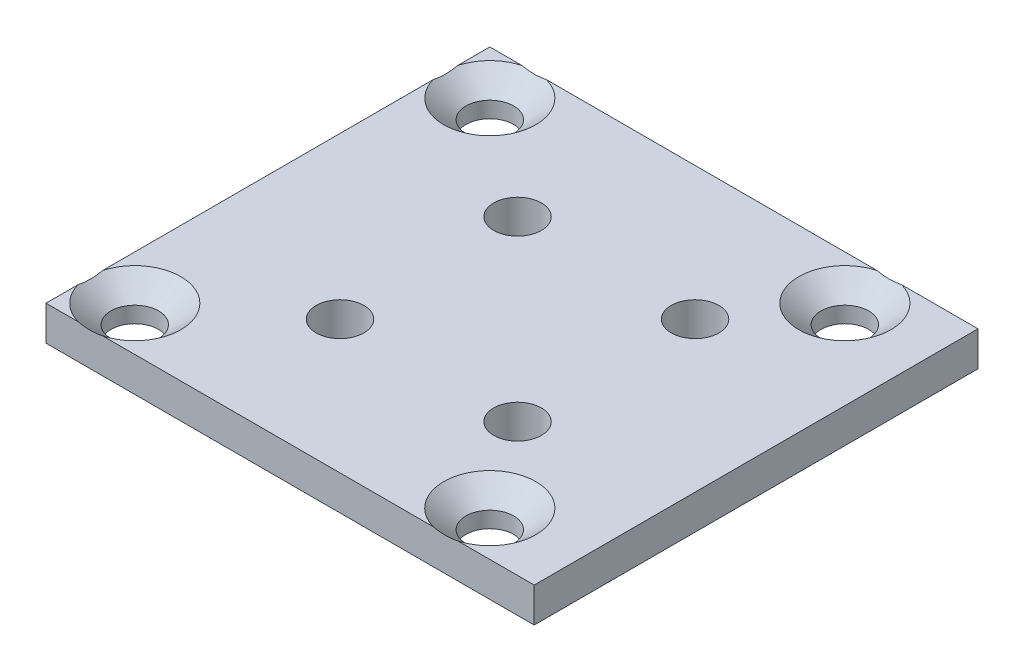
from build123d import *

# Parameters (mm, degrees)
SKETCH1_W            = 43
SKETCH1_H            = 40
BOSS_EXTRUDE1_DEPTH  = 3.125
M4_CLEARANCE_HOLE1_D = 4.3
M4_CLEARANCE_HOLE2_D = 4.3
SKETCH7_W            = 40
SKETCH7_H            = 3.125
BOSS_EXTRUDE2_DEPTH  = 1
CHAMFER1_SIZE        = 2
CHAMFER1_SIZE_2      = 1.678199262


with BuildPart() as part:
    # Sketch1 → Boss-Extrude1 (new body)
    with BuildSketch(Plane(origin=(0, 0, 0), x_dir=(1, 0, 0), z_dir=(0, 1, 0))):
        Rectangle(SKETCH1_W, SKETCH1_H)
    extrude(amount=BOSS_EXTRUDE1_DEPTH)

    # M4 Clearance Hole1 (through all)
    with Locations(Plane(origin=(0, 3.125, 0), x_dir=(1, 0, 0), z_dir=(0, 1, 0))):
        with Locations((-18.5, 16), (13.5, 16), (13.5, -16), (-18.5, -16)):
            Hole(M4_CLEARANCE_HOLE1_D / 2)

    # M4 Clearance Hole2 (through all)
    with Locations(Plane(origin=(0, 3.125, 0), x_dir=(1, 0, 0), z_dir=(0, 1, 0))):
        with Locations((-8, 8), (8, 8), (8, -8), (-8, -8)):
            Hole(M4_CLEARANCE_HOLE2_D / 2)

    # Sketch7 → Boss-Extrude2 (add)
    with BuildSketch(Plane.ZY.offset(21.5)):
        with Locations((0, 1.5625)):
            Rectangle(SKETCH7_W, SKETCH7_H)
    extrude(amount=BOSS_EXTRUDE2_DEPTH)

    # Chamfer1
    # the kernel refuses this chamfer: 2, 1.678199262 mm, written as the material it takes off along each edge
    with BuildSketch(Plane(origin=(-18.5, 3.125, 16), x_dir=(-1, 0, 0), z_dir=(0, 0, 1))) as chamfer1_piece_1:
        Polygon((2.15 + CHAMFER1_SIZE, 0), (2.15, CHAMFER1_SIZE_2), (2.15, 0), align=None)
    revolve(axis=Axis((-18.5, 3.125, 16), (0, -1, 0)), mode=Mode.SUBTRACT)
    with BuildSketch(Plane(origin=(13.5, 3.125, 16), x_dir=(-1, 0, 0), z_dir=(0, 0, 1))) as chamfer1_piece_2:
        Polygon((2.15 + CHAMFER1_SIZE, 0), (2.15, CHAMFER1_SIZE_2), (2.15, 0), align=None)
    revolve(axis=Axis((13.5, 3.125, 16), (0, -1, 0)), mode=Mode.SUBTRACT)
    with BuildSketch(Plane(origin=(13.5, 3.125, -16), x_dir=(-1, 0, 0), z_dir=(0, 0, 1))) as chamfer1_piece_3:
        Polygon((2.15 + CHAMFER1_SIZE, 0), (2.15, CHAMFER1_SIZE_2), (2.15, 0), align=None)
    revolve(axis=Axis((13.5, 3.125, -16), (0, -1, 0)), mode=Mode.SUBTRACT)
    with BuildSketch(Plane(origin=(-18.5, 3.125, -16), x_dir=(-1, 0, 0), z_dir=(0, 0, 1))) as chamfer1_piece_4:
        Polygon((2.15 + CHAMFER1_SIZE, 0), (2.15, CHAMFER1_SIZE_2), (2.15, 0), align=None)
    revolve(axis=Axis((-18.5, 3.125, -16), (0, -1, 0)), mode=Mode.SUBTRACT)


solid = part.part
